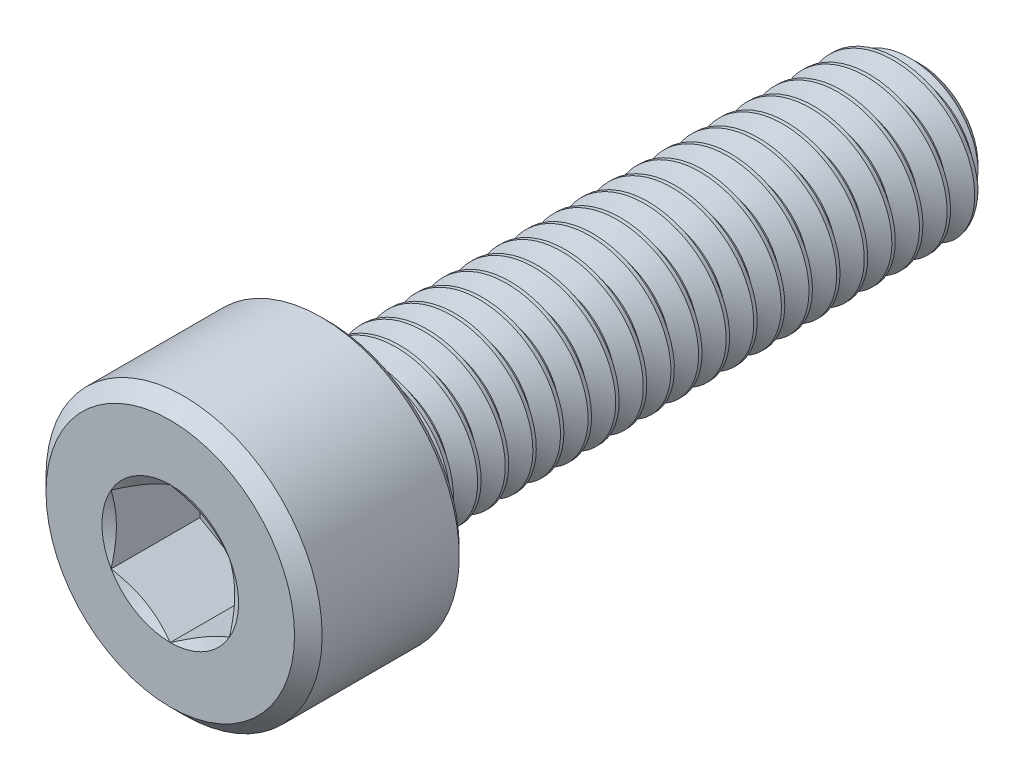
from build123d import *

# Parameters (mm, degrees)
CUT_EXTRUDE1_DEPTH = 2.25
CHAMFER1_SIZE      = 0.35
CHAMFER2_SIZE      = 0.175
CUT_SWEEP1_PITCH   = 0.7


with BuildPart() as part:
    # Sketch2 → Revolve1 (revolve)
    with BuildSketch(Plane(origin=(0, 0, 0), x_dir=(0, 0, -1), z_dir=(1, 0, 0)), mode=Mode.PRIVATE) as revolve1_sk:
        Polygon((9.5, 1.475), (8.975, 2), (-5.5, 2), (-5.5, 3.5), (-9.5, 3.5), (-9.5, 0), (9.5, 0), align=None)
    revolve(revolve1_sk.sketch.rotate(Axis((0, 0, -9.5), (0, 0, 1)), 90), axis=Axis((0, 0, -9.5), (0, 0, 1)))

    # Sketch4 → Cut-Extrude1 (cut)
    with BuildSketch(Plane.XY.offset(9.5)):
        Polygon((0, 1.732050808), (-1.5, 0.866025404), (-1.5, -0.866025404), (0, -1.732050808), (1.5, -0.866025404), (1.5, 0.866025404), align=None)
    extrude(amount=-CUT_EXTRUDE1_DEPTH, mode=Mode.SUBTRACT)

    # Cut-Extrude2 cone 1 section (through the dimple's axis) → Cut-Extrude2 (revolve, cut)
    with BuildSketch(Plane(origin=(0, 0, 9.5), x_dir=(0, -1, 0), z_dir=(1, 0, 0))):
        Polygon((0, 0), (1.732050808, 0), (0, 1), align=None)
    revolve(axis=Axis((0, 0, 9.5), (0, 0, -1)), mode=Mode.SUBTRACT)

    # Chamfer1
    chamfer1_edges = [part.edges().sort_by_distance(p)[0] for p in [
        (3.5, 0, 9.5),
    ]]
    chamfer(chamfer1_edges, length=CHAMFER1_SIZE)

    # Chamfer2
    chamfer2_edges = [part.edges().sort_by_distance(p)[0] for p in [
        (3.5, 0, 5.5),
    ]]
    chamfer(chamfer2_edges, length=CHAMFER2_SIZE)

    # Cut-Sweep1: arcs per turn and ends read off the stored shape
    # Cut-Sweep1: the profile of Sketch7 profile screwed along a right-hand helix through 21.928571 turns, 6 arcs to a turn; built about Z, then put on its axis
    cut_sweep1_z = Axis((0, 0, 0), (0, 0, 1))
    cut_sweep1_corners = [(2.0003, 0, 0.000173205), (2.0003, 0, -0.612673205), (1.545336663, 0, -0.35), (1.545336663, 0, -0.2625)]
    with BuildLine(mode=Mode.PRIVATE) as cut_sweep1_profile:
        Line(cut_sweep1_corners[0], cut_sweep1_corners[1])
        Line(cut_sweep1_corners[1], cut_sweep1_corners[2])
        Line(cut_sweep1_corners[2], cut_sweep1_corners[3])
        Line(cut_sweep1_corners[3], cut_sweep1_corners[0])
    cut_sweep1_cap = Face(cut_sweep1_profile.wire())
    cut_sweep1_turn_angles = [0, 30, 60, 90, 120, 150, 180, 210, 240, 270, 300, 330, 360]
    cut_sweep1_turn_weights = [1, 0.8660254037844387, 1, 0.8660254037844387, 1, 0.8660254037844387, 1, 0.8660254037844387, 1, 0.8660254037844387, 1, 0.8660254037844387, 1]
    cut_sweep1_turn_rails = [Edge.make_bspline([Vector(p[0], p[1], 0).rotate(cut_sweep1_z, cut_sweep1_turn_angles[k]) / cut_sweep1_turn_weights[k] + Vector(0, 0, p[2] + CUT_SWEEP1_PITCH * cut_sweep1_turn_angles[k] / 360) for k in range(13)], [0, 0, 0, 1, 1, 2, 2, 3, 3, 4, 4, 5, 5, 6, 6, 6], 2, cut_sweep1_turn_weights) for p in cut_sweep1_corners]
    cut_sweep1_turn_sides = [Face.make_surface_from_curves(cut_sweep1_turn_rails[p[0]], cut_sweep1_turn_rails[p[1]]) for p in [(0, 1), (1, 2), (2, 3), (3, 0)]]
    cut_sweep1_last_angles = [7560, 7590, 7620, 7650, 7680, 7710, 7740, 7770, 7800, 7830, 7860, 7877.142857143, 7894.285714286]
    cut_sweep1_last_weights = [1, 0.8660254037844387, 1, 0.8660254037844387, 1, 0.8660254037844387, 1, 0.8660254037844387, 1, 0.8660254037844387, 1, 0.955572805786348, 1]
    cut_sweep1_last_rails = [Edge.make_bspline([Vector(p[0], p[1], 0).rotate(cut_sweep1_z, cut_sweep1_last_angles[k]) / cut_sweep1_last_weights[k] + Vector(0, 0, p[2] + CUT_SWEEP1_PITCH * cut_sweep1_last_angles[k] / 360) for k in range(13)], [0, 0, 0, 1, 1, 2, 2, 3, 3, 4, 4, 5, 5, 6, 6, 6], 2, cut_sweep1_last_weights) for p in cut_sweep1_corners]
    cut_sweep1_last_sides = [Face.make_surface_from_curves(cut_sweep1_last_rails[p[0]], cut_sweep1_last_rails[p[1]]) for p in [(0, 1), (1, 2), (2, 3), (3, 0)]]
    cut_sweep1 = Plane(origin=(0, 0, -9.5), x_dir=(0, 1, 0), z_dir=(0, 0, 1)) * Solid(Shell([*[p.moved(Location((0, 0, CUT_SWEEP1_PITCH * i))) for i in range(21) for p in cut_sweep1_turn_sides], *cut_sweep1_last_sides, cut_sweep1_cap, cut_sweep1_cap.rotate(cut_sweep1_z, 7894.285714286).moved(Location((0, 0, CUT_SWEEP1_PITCH * 7894.285714286 / 360)))]))
    add(cut_sweep1, mode=Mode.SUBTRACT)

    # Sketch8 → Revolve2 (revolve)
    with BuildSketch(Plane(origin=(0, 0, 0), x_dir=(0, 0, -1), z_dir=(1, 0, 0)), mode=Mode.PRIVATE) as revolve2_sk:
        Polygon((-7.25, 0), (-7.25, 2.037888611), (-5.15, 2.037888611), (-3.973424462, 0), align=None)
    revolve(revolve2_sk.sketch.rotate(Axis((0, 0, 3.973424462), (0, 0, 1)), 277.696668939), axis=Axis((0, 0, 3.973424462), (0, 0, 1)))


solid = part.part
